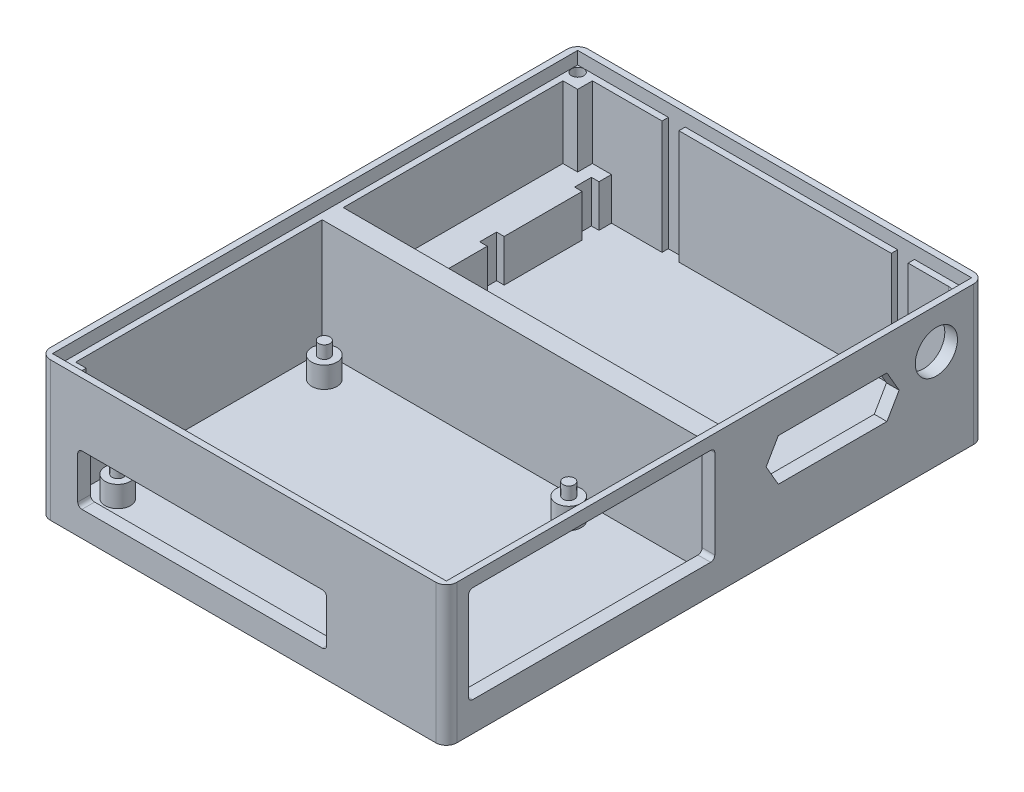
from build123d import *

# Parameters (mm, degrees)
SKETCH1_W                  = 165
SKETCH1_H                  = 155.8
BOSS_EXTRUDE1_DEPTH        = 3
SKETCH2_R                  = 3
SKETCH2_R_2                = 1.35
BOSS_EXTRUDE2_DEPTH        = 5
SKETCH5_RX                 = 1.35
SKETCH5_RY                 = 1.35
BOSS_EXTRUDE3_DEPTH        = 8
SKETCH6_W                  = 155.8
SKETCH6_H                  = 3
BOSS_EXTRUDE4_DEPTH        = 3
SKETCH7_W                  = 74.55
SKETCH7_H                  = 155.8
CUT_EXTRUDE1_DEPTH         = 3
SKETCH11_W                 = 93.45
SKETCH11_H                 = 34.19
CUT_EXTRUDE2_DEPTH         = 3
SKETCH12_W                 = 121.61
SKETCH12_H                 = 3
BOSS_EXTRUDE5_DEPTH        = 3
SKETCH13_W                 = 96.45
SKETCH13_H                 = 3
BOSS_EXTRUDE6_DEPTH        = 6
SKETCH14_W                 = 96.45
SKETCH14_H                 = 127.61
SKETCH14_W_2               = 90.45
SKETCH14_H_2               = 121.61
BOSS_EXTRUDE8_DEPTH        = 30
SKETCH15_W                 = 58.420771098
SKETCH15_H                 = 23
CUT_EXTRUDE3_DEPTH         = 30
SKETCH16_W                 = 59.038575843
SKETCH16_H                 = 12
CUT_EXTRUDE4_DEPTH         = 30
SKETCH17_W                 = 93.45
SKETCH17_H                 = 124.61
CUT_EXTRUDE5_DEPTH         = 3
CUT_EXTRUDE6_DEPTH         = 3
FILLET1_R                  = 2.5
FILLET3_R                  = 2.5
FILLET4_R                  = 2.5
FILLET5_R                  = 2.5
FILLET6_R                  = 2.5
FILLET7_R                  = 2.5
FILLET8_R                  = 2.5
FILLET9_R                  = 2.5
FILLET10_R                 = 1
FILLET11_R                 = 1
FILLET12_R                 = 1
FILLET13_R                 = 1
FILLET14_R                 = 1
FILLET15_R                 = 1
FILLET16_R                 = 1
FILLET17_R                 = 1
SKETCH23_R                 = 5
CUT_EXTRUDE11_DEPTH        = 10
SKETCH26_W                 = 90.45
SKETCH26_H                 = 5
BOSS_EXTRUDE9_DEPTH        = 27
BOSS_EXTRUDE10_DEPTH       = 10
SKETCH28_W                 = 4
SKETCH28_H                 = 27
CUT_EXTRUDE12_DEPTH        = 1.5
SKETCH29_W                 = 5
SKETCH29_H                 = 5
BOSS_EXTRUDE11_DEPTH       = 17
SKETCH30_W                 = 4
SKETCH30_H                 = 4
BOSS_EXTRUDE12_DEPTH       = 27
M2_5_CLEARANCE_HOLE1_D     = 2.9
M2_5_CLEARANCE_HOLE1_DEPTH = 6
M2_5_CLEARANCE_HOLE1_TIP   = 0.871247898


with BuildPart() as part:
    # Sketch1 → Boss-Extrude1 (new body)
    with BuildSketch(Plane(origin=(0, 0, 0), x_dir=(1, 0, 0), z_dir=(0, 1, 0))):
        Rectangle(SKETCH1_W, SKETCH1_H)
    extrude(amount=BOSS_EXTRUDE1_DEPTH)

    # Sketch2 → Boss-Extrude2 (add)
    with BuildSketch(Plane(origin=(0, 3, 0), x_dir=(1, 0, 0), z_dir=(0, 1, 0))):
        with Locations(Location((1.05, -25.4, 0), (0, 0, 90))):
            Circle(SKETCH2_R)
        with Locations(Location((1.05, -25.4, 0), (0, 0, 270))):
            Circle(SKETCH2_R_2, mode=Mode.SUBTRACT)
    boss_extrude2 = extrude(amount=BOSS_EXTRUDE2_DEPTH)

    # Sketch5 → Boss-Extrude3 (add)
    with BuildSketch(Plane(origin=(0, 3, 0), x_dir=(1, 0, 0), z_dir=(0, 1, 0))):
        with Locations((1.05, -25.4)):
            Ellipse(SKETCH5_RX, SKETCH5_RY)
    boss_extrude3 = extrude(amount=BOSS_EXTRUDE3_DEPTH)

    # Sketch-Pattern1: Boss-Extrude2, Boss-Extrude3 at 3 more places
    with Locations((58, 0, 49), (0, 0, 49), (58, 0, 0)):
        add(boss_extrude2)
        add(boss_extrude3)

    # Sketch6 → Boss-Extrude4 (add)
    with BuildSketch(Plane(origin=(82.5, 0, 0), x_dir=(0, 0, -1), z_dir=(1, 0, 0))):
        with Locations((0, 1.5)):
            Rectangle(SKETCH6_W, SKETCH6_H)
    extrude(amount=BOSS_EXTRUDE4_DEPTH)

    # Sketch7 → Cut-Extrude1 (cut)
    with BuildSketch(Plane(origin=(0, 3, 0), x_dir=(1, 0, 0), z_dir=(0, 1, 0))):
        with Locations((-45.225, 0)):
            Rectangle(SKETCH7_W, SKETCH7_H)
    extrude(amount=-CUT_EXTRUDE1_DEPTH, mode=Mode.SUBTRACT)

    # Sketch11 → Cut-Extrude2 (cut)
    with BuildSketch(Plane(origin=(0, 3, 0), x_dir=(1, 0, 0), z_dir=(0, 1, 0))):
        with Locations((38.775, 60.805)):
            Rectangle(SKETCH11_W, SKETCH11_H)
    extrude(amount=-CUT_EXTRUDE2_DEPTH, mode=Mode.SUBTRACT)

    # Sketch12 → Boss-Extrude5 (add)
    with BuildSketch(Plane(origin=(85.5, 0, 0), x_dir=(0, 0, -1), z_dir=(1, 0, 0))):
        with Locations((-17.095, 1.5)):
            Rectangle(SKETCH12_W, SKETCH12_H)
    extrude(amount=BOSS_EXTRUDE5_DEPTH)

    # Sketch13 → Boss-Extrude6 (add)
    with BuildSketch(Plane.XY.offset(77.9)):
        with Locations((40.275, 1.5)):
            Rectangle(SKETCH13_W, SKETCH13_H)
    extrude(amount=BOSS_EXTRUDE6_DEPTH)

    # Sketch14 → Boss-Extrude8 (add)
    with BuildSketch(Plane(origin=(0, 3, 0), x_dir=(1, 0, 0), z_dir=(0, 1, 0))):
        with Locations((40.275, -20.095)):
            Rectangle(SKETCH14_W, SKETCH14_H)
        with Locations((40.275, -20.095)):
            Rectangle(SKETCH14_W_2, SKETCH14_H_2, mode=Mode.SUBTRACT)
    extrude(amount=BOSS_EXTRUDE8_DEPTH)

    # Sketch15 → Cut-Extrude3 (cut)
    with BuildSketch(Plane.ZY.offset(-85.5)):
        with Locations((49.418063701, 18.5)):
            Rectangle(SKETCH15_W, SKETCH15_H)
    extrude(amount=-CUT_EXTRUDE3_DEPTH, mode=Mode.SUBTRACT)

    # Sketch16 → Cut-Extrude4 (cut)
    with BuildSketch(Plane(origin=(0, 0, 80.9), x_dir=(-1, 0, 0), z_dir=(0, 0, -1))):
        with Locations((-30.569287921, 12)):
            Rectangle(SKETCH16_W, SKETCH16_H)
    extrude(amount=-CUT_EXTRUDE4_DEPTH, mode=Mode.SUBTRACT)

    # Sketch17 → Cut-Extrude5 (cut)
    with BuildSketch(Plane(origin=(0, 33, 0), x_dir=(1, 0, 0), z_dir=(0, 1, 0))):
        with Locations((40.275, -20.095)):
            Rectangle(SKETCH17_W, SKETCH17_H)
    extrude(amount=-CUT_EXTRUDE5_DEPTH, mode=Mode.SUBTRACT)

    # Sketch19 → Cut-Extrude6 (cut)
    with BuildSketch(Plane.ZY.offset(-85.5)):
        Polygon((-14.863248654, 25), (-20.636751346, 25), (-23.523502692, 20), (-20.636751346, 15), (-14.863248654, 15), (-0.636751346, 15), (5.136751346, 15), (8.023502692, 20), (5.136751346, 25), (-0.636751346, 25), align=None)
    extrude(amount=-CUT_EXTRUDE6_DEPTH, mode=Mode.SUBTRACT)

    # Fillet1
    fillet1_edges = [part.edges().sort_by_distance(p)[0] for p in [
        (-7.95, 16.5, 83.9),
    ]]
    fillet(fillet1_edges, radius=FILLET1_R)

    # Fillet3
    fillet3_edges = [part.edges().sort_by_distance(p)[0] for p in [
        (88.5, 16.5, 83.9),
    ]]
    fillet(fillet3_edges, radius=FILLET3_R)

    # Fillet4
    fillet4_edges = [part.edges().sort_by_distance(p)[0] for p in [
        (88.5, 16.5, -43.71),
    ]]
    fillet(fillet4_edges, radius=FILLET4_R)

    # Fillet5
    fillet5_edges = [part.edges().sort_by_distance(p)[0] for p in [
        (-7.95, 16.5, -43.71),
    ]]
    fillet(fillet5_edges, radius=FILLET5_R)

    # Fillet6
    fillet6_edges = [part.edges().sort_by_distance(p)[0] for p in [
        (85.5, 16.5, -40.71),
    ]]
    fillet(fillet6_edges, radius=FILLET6_R)

    # Fillet7
    fillet7_edges = [part.edges().sort_by_distance(p)[0] for p in [
        (-4.95, 16.5, -40.71),
    ]]
    fillet(fillet7_edges, radius=FILLET7_R)

    # Fillet8
    fillet8_edges = [part.edges().sort_by_distance(p)[0] for p in [
        (-4.95, 16.5, 80.9),
    ]]
    fillet(fillet8_edges, radius=FILLET8_R)

    # Fillet9
    fillet9_edges = [part.edges().sort_by_distance(p)[0] for p in [
        (85.5, 16.5, 80.9),
    ]]
    fillet(fillet9_edges, radius=FILLET9_R)

    # Fillet10
    # the kernel refuses this fillet: 1 mm, written as the material it adds along each edge
    with BuildSketch(Plane(origin=(84.5, 30, 78.62844925), x_dir=(0, -1, 0), z_dir=(1, 0, 0))) as fillet10_piece_1_section:
        with BuildLine():
            CenterArc((FILLET10_R, FILLET10_R), FILLET10_R, 180, 90)
            Line((0, FILLET10_R), (0, 0))
            Line((0, 0), (FILLET10_R, 0))
        make_face()
    fillet10_piece_1 = extrude(amount=4, mode=Mode.PRIVATE)
    fillet10_piece_1 = fillet10_piece_1 - Plane(origin=(83, 29.753252257, 78.4), x_dir=(0, 0, 1), z_dir=(0, 1, 0)) * Cylinder(2.5, 12, mode=Mode.PRIVATE)
    fillet10_piece_1 = split(fillet10_piece_1, bisect_by=Plane(origin=(86.246243514, 30, 78.424249714), z_dir=(0, -1, 0)), keep=Keep.TOP, mode=Mode.PRIVATE)
    fillet10_piece_1 = split(fillet10_piece_1, bisect_by=Plane(origin=(87, 29.753252257, 78.424249714), z_dir=(-1, 0, 0)), keep=Keep.TOP, mode=Mode.PRIVATE)
    add(fillet10_piece_1)
    with BuildSketch(Plane(origin=(87, 30, 78.62844925), x_dir=(0, -1, 0), z_dir=(1, 0, 0))) as fillet10_piece_2_section:
        with BuildLine():
            CenterArc((FILLET10_R, FILLET10_R), FILLET10_R, 180, 90)
            Line((0, FILLET10_R), (0, 0))
            Line((0, 0), (FILLET10_R, 0))
        make_face()
    fillet10_piece_2 = extrude(amount=1.5, mode=Mode.PRIVATE)
    fillet10_piece_2 = split(fillet10_piece_2, bisect_by=Plane(origin=(87.75, 30, 78.42497612), z_dir=(0, -1, 0)), keep=Keep.TOP, mode=Mode.PRIVATE)
    add(fillet10_piece_2)

    # Fillet11
    # the kernel refuses this fillet: 1 mm, written as the material it adds along each edge
    with BuildSketch(Plane(origin=(84.5, 30, 20.207678152), x_dir=(0, -1, 0), z_dir=(1, 0, 0))) as fillet11_piece_1_section:
        with BuildLine():
            CenterArc((FILLET11_R, -FILLET11_R), FILLET11_R, 90, 90)
            Line((0, -FILLET11_R), (0, 0))
            Line((0, 0), (FILLET11_R, 0))
        make_face()
    fillet11_piece_1 = extrude(amount=4, mode=Mode.PRIVATE)
    fillet11_piece_1 = split(fillet11_piece_1, bisect_by=Plane(origin=(86.25, 30, 20.411151282), z_dir=(0, -1, 0)), keep=Keep.TOP, mode=Mode.PRIVATE)
    fillet11_piece_1 = split(fillet11_piece_1, bisect_by=Plane(origin=(85.5, 29.75304895, 20.411151282), z_dir=(1, 0, 0)), keep=Keep.TOP, mode=Mode.PRIVATE)
    fillet11_piece_1 = split(fillet11_piece_1, bisect_by=Plane(origin=(87, 29.75304895, 20.411151282), z_dir=(-1, 0, 0)), keep=Keep.TOP, mode=Mode.PRIVATE)
    add(fillet11_piece_1)
    with BuildSketch(Plane(origin=(87, 30, 20.207678152), x_dir=(0, -1, 0), z_dir=(1, 0, 0))) as fillet11_piece_2_section:
        with BuildLine():
            CenterArc((FILLET11_R, -FILLET11_R), FILLET11_R, 90, 90)
            Line((0, -FILLET11_R), (0, 0))
            Line((0, 0), (FILLET11_R, 0))
        make_face()
    fillet11_piece_2 = extrude(amount=1.5, mode=Mode.PRIVATE)
    fillet11_piece_2 = split(fillet11_piece_2, bisect_by=Plane(origin=(87.75, 30, 20.411151282), z_dir=(0, -1, 0)), keep=Keep.TOP, mode=Mode.PRIVATE)
    add(fillet11_piece_2)

    # Fillet12
    fillet12_edges = [part.edges().sort_by_distance(p)[0] for p in [
        (87, 7, 20.207678152),
    ]]
    fillet(fillet12_edges, radius=FILLET12_R)

    # Fillet13
    fillet13_edges = [part.edges().sort_by_distance(p)[0] for p in [
        (86.994770154, 7, 78.62844925),
    ]]
    fillet(fillet13_edges, radius=FILLET13_R)

    # Fillet14
    fillet14_edges = [part.edges().sort_by_distance(p)[0] for p in [
        (1.05, 18, 82.4),
    ]]
    fillet(fillet14_edges, radius=FILLET14_R)

    # Fillet15
    fillet15_edges = [part.edges().sort_by_distance(p)[0] for p in [
        (60.088575843, 6, 82.4),
    ]]
    fillet(fillet15_edges, radius=FILLET15_R)

    # Fillet16
    fillet16_edges = [part.edges().sort_by_distance(p)[0] for p in [
        (60.088575843, 18, 82.4),
    ]]
    fillet(fillet16_edges, radius=FILLET16_R)

    # Fillet17
    fillet17_edges = [part.edges().sort_by_distance(p)[0] for p in [
        (1.05, 6, 82.4),
    ]]
    fillet(fillet17_edges, radius=FILLET17_R)

    # Sketch23 → Cut-Extrude11 (cut)
    with BuildSketch(Plane(origin=(88.5, 0, 0), x_dir=(0, 0, -1), z_dir=(1, 0, 0))):
        with Locations((32.366751346, 23.5)):
            Circle(SKETCH23_R)
    extrude(amount=-CUT_EXTRUDE11_DEPTH, mode=Mode.SUBTRACT)

    # Sketch26 → Boss-Extrude9 (add)
    with BuildSketch(Plane(origin=(0, 3, 0), x_dir=(1, 0, 0), z_dir=(0, 1, 0))):
        with Locations((40.275, -17.4)):
            Rectangle(SKETCH26_W, SKETCH26_H)
    extrude(amount=BOSS_EXTRUDE9_DEPTH)

    # Sketch27 → Boss-Extrude10 (add)
    with BuildSketch(Plane(origin=(0, 3, 0), x_dir=(1, 0, 0), z_dir=(0, 1, 0))):
        Polygon((3.0643, -14.9), (-4.95, -14.9), (-4.95, 40.757951229), (3.0643, 40.757951229), (3.0643, 37.757951229), (1.2643, 37.757951229), (1.2643, 33.757951229), (3.0643, 33.757951229), (3.0643, 15.257951229), (1.2643, 15.257951229), (1.2643, 11.257951229), (3.0643, 11.257951229), (3.0643, -7.242048771), (1.2643, -7.242048771), (1.2643, -11.242048771), (3.0643, -11.242048771), align=None)
    extrude(amount=BOSS_EXTRUDE10_DEPTH)

    # Sketch28 → Cut-Extrude12 (cut)
    with BuildSketch(Plane.XY.offset(-40.71)):
        with Locations((17.0643, 16.5)):
            Rectangle(SKETCH28_W, SKETCH28_H)
        with Locations((71.4643, 16.5)):
            Rectangle(SKETCH28_W, SKETCH28_H)
    extrude(amount=-CUT_EXTRUDE12_DEPTH, mode=Mode.SUBTRACT)

    # Sketch29 → Boss-Extrude11 (add)
    with BuildSketch(Plane(origin=(0, 13, 0), x_dir=(1, 0, 0), z_dir=(0, 1, 0))):
        with Locations((-3.95, 39.71)):
            Rectangle(SKETCH29_W, SKETCH29_H)
    extrude(amount=BOSS_EXTRUDE11_DEPTH)

    # Sketch30 → Boss-Extrude12 (add)
    with BuildSketch(Plane(origin=(0, 3, 0), x_dir=(1, 0, 0), z_dir=(0, 1, 0))):
        with Locations((-4.45, -80.4)):
            Rectangle(SKETCH30_W, SKETCH30_H)
    extrude(amount=BOSS_EXTRUDE12_DEPTH)

    # M2.5 Clearance Hole1
    with Locations(Plane(origin=(-4.95, 30, -40.71), x_dir=(0, 0, 1), z_dir=(0, 1, 0))):
        with Locations((0, 0), (121.61, 0)):
            Hole(M2_5_CLEARANCE_HOLE1_D / 2, depth=M2_5_CLEARANCE_HOLE1_DEPTH)
            with Locations((0, 0, -(M2_5_CLEARANCE_HOLE1_DEPTH + M2_5_CLEARANCE_HOLE1_TIP / 2))):  # 118° drill point
                Cone(0, M2_5_CLEARANCE_HOLE1_D / 2, M2_5_CLEARANCE_HOLE1_TIP, mode=Mode.SUBTRACT)


solid = part.part
